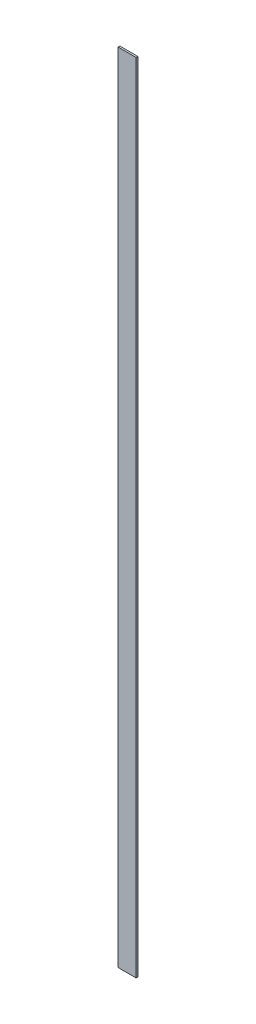
from build123d import *

# Parameters (mm, degrees)
EXTRUDE_1_DEPTH     = 2200
CUT_EXTRUDE_1_DEPTH = 2202.028168834


with BuildPart() as part:
    # Эскиз1 → Вытянуть-Тонкостенный1 (new body)
    with BuildSketch(Plane(origin=(0, 0, 0), x_dir=(1, 0, 0), z_dir=(0, 1, 0))):
        Polygon((0, 45), (0, 0), (45, 0), (45, -5), (-5, -5), (-5, 45), align=None)
    extrude(amount=EXTRUDE_1_DEPTH)

    # Эскиз2 → Вырез-Вытянуть1 (cut, through all)
    with BuildSketch(Plane.ZY.offset(5)):
        Polygon((0, 0), (-45, 45), (-45, 0), align=None)
        Polygon((-45, 2200), (0, 2200), (-45, 2155), align=None)
    extrude(amount=-CUT_EXTRUDE_1_DEPTH, mode=Mode.SUBTRACT)


solid = part.part
